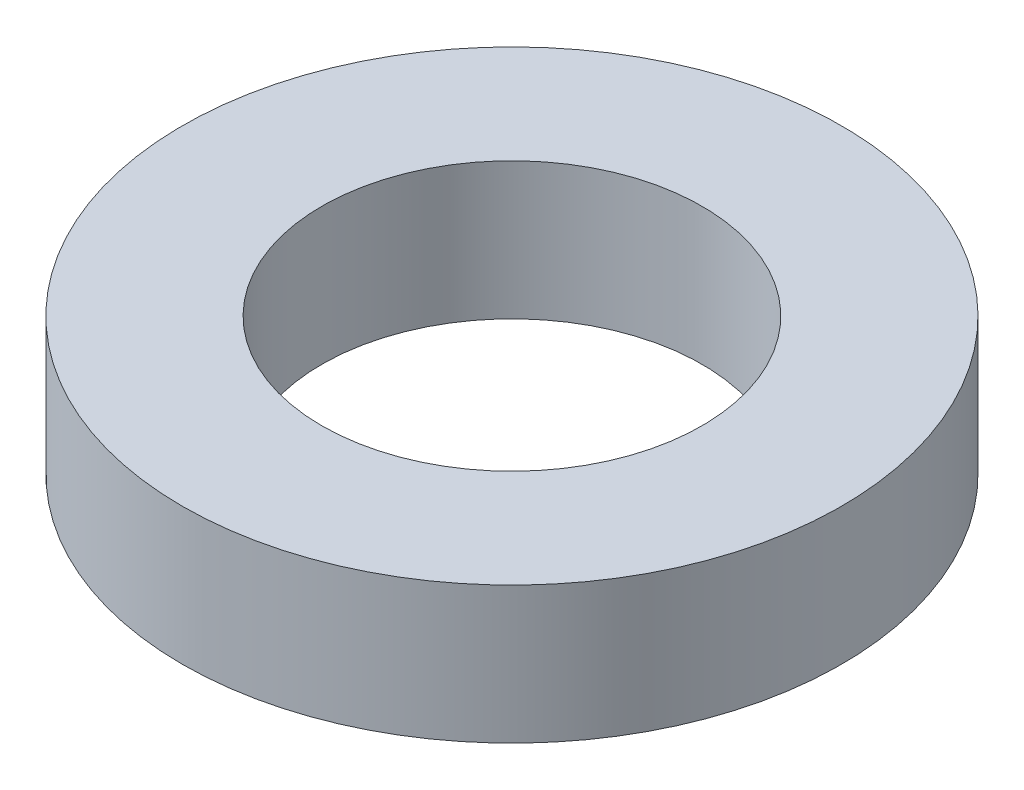
from build123d import *

# Parameters (mm, degrees)
SKETCH1_R           = 65
BOSS_EXTRUDE1_DEPTH = 27
SKETCH2_R           = 37.5
CUT_EXTRUDE1_DEPTH  = 96.807097858


with BuildPart() as part:
    # Sketch1 → Boss-Extrude1 (new body)
    with BuildSketch(Plane(origin=(0, 0, 0), x_dir=(1, 0, 0), z_dir=(0, 1, 0))):
        Circle(SKETCH1_R)
    extrude(amount=BOSS_EXTRUDE1_DEPTH)

    # Sketch2 → Cut-Extrude1 (cut, through all)
    with BuildSketch(Plane(origin=(0, 0, 0), x_dir=(1, 0, 0), z_dir=(0, 1, 0))):
        Circle(SKETCH2_R)
    extrude(amount=CUT_EXTRUDE1_DEPTH, mode=Mode.SUBTRACT)


solid = part.part
